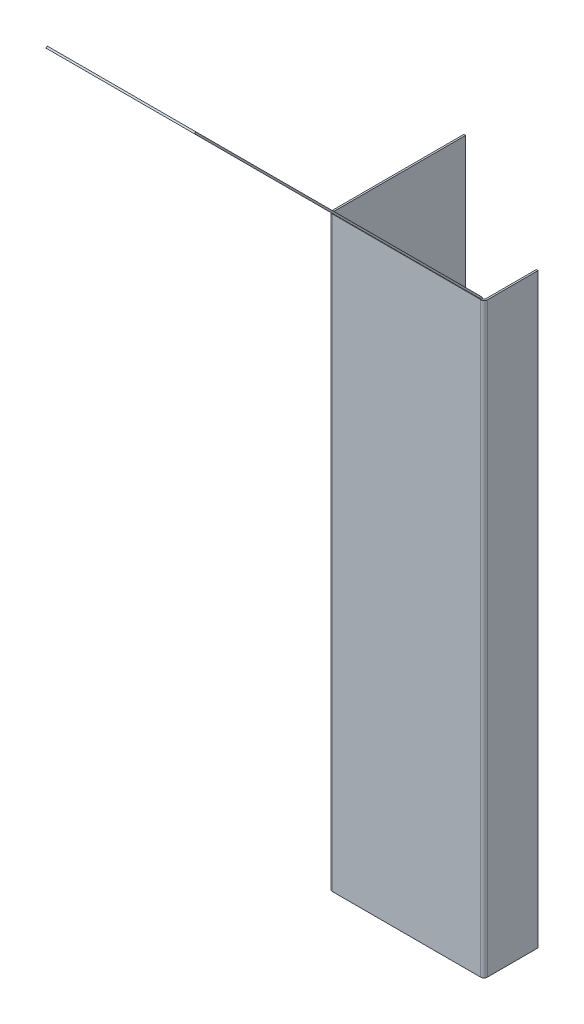
from build123d import *

# Parameters (mm, degrees)
BASE_FLANGE1_DEPTH = 69.85
EDGE_FLANGE1_DEPTH = 276.04689029
EDGE_FLANGE3_DEPTH = 276.04689029
CUT_EXTRUDE1_REACH = 441.211
SKETCH16_W         = 8.739840912
SKETCH16_H         = 76.2


# Sheet-metal steps are written as plain solids
with BuildPart() as part:
    # Sketch1 → Base-Flange1 (new body)
    with BuildSketch(Plane(origin=(0, 0, 0), x_dir=(0, 0, -1), z_dir=(1, 0, 0))):
        with BuildLine():
            Line((0, 0), (0, 276.04689029))
            ThreePointArc((0, 276.04689029), (-0.056070336, 276.328774906), (-0.215745145, 276.567745145))
            Line((-0.215745145, 276.567745145), (-134.703841816, 411.055841816))
            Line((-134.703841816, 411.055841816), (-134.129105424, 411.630578208))
            Line((-134.129105424, 411.630578208), (0.358991247, 277.142481537))
            ThreePointArc((0.358991247, 277.142481537), (0.694858948, 276.63982), (0.8128, 276.04689029))
            Line((0.8128, 276.04689029), (0.8128, 0))
            Line((0.8128, 0), (0, 0))
        make_face()
    extrude(amount=BASE_FLANGE1_DEPTH)

    # Edge-Flange1 section (across the edge) → Edge-Flange1 (add)
    with BuildSketch(Plane(origin=(70.5866, 276.04689029, -0.8128), x_dir=(-1, 0, 0), z_dir=(0, -1, 0))):
        with BuildLine():
            Line((-0.8128, 0.7366), (-0.8128, 24.5872))
            Line((-0.8128, 24.5872), (0, 24.5872))
            Line((0, 24.5872), (0, 0.7366))
            ThreePointArc((0, 0.7366), (0.215745145, 0.215745145), (0.7366, 0))
            Line((0.7366, 0), (0.7366, -0.8128))
            ThreePointArc((0.7366, -0.8128), (-0.358991247, -0.358991247), (-0.8128, 0.7366))
        make_face()
    extrude(amount=EDGE_FLANGE1_DEPTH)

    # Edge-Flange3 section (across the edge) → Edge-Flange3 (add)
    with BuildSketch(Plane(origin=(-0.7366, 0, -0.8128), x_dir=(1, 0, 0), z_dir=(0, 1, 0))):
        with BuildLine():
            Line((-0.8128, 0.7366), (-0.8128, 62.6872))
            Line((-0.8128, 62.6872), (0, 62.6872))
            Line((0, 62.6872), (0, 0.7366))
            ThreePointArc((0, 0.7366), (0.215745145, 0.215745145), (0.7366, 0))
            Line((0.7366, 0), (0.7366, -0.8128))
            ThreePointArc((0.7366, -0.8128), (-0.358991247, -0.358991247), (-0.8128, 0.7366))
        make_face()
    extrude(amount=EDGE_FLANGE3_DEPTH)

    # Sketch16 → Cut-Extrude1 (cut, up to next)
    with BuildSketch(Plane.ZY.offset(1.5494), mode=Mode.PRIVATE) as cut_extrude1_sk1:
        with Locations((-59.130079544, 92.075)):
            Rectangle(SKETCH16_W, SKETCH16_H)
    cut_extrude1_tool1 = extrude(cut_extrude1_sk1.sketch, amount=-CUT_EXTRUDE1_REACH, mode=Mode.PRIVATE) & part.part
    add(cut_extrude1_tool1.solids().sort_by_distance((-1.5494, 92.075, -59.13008))[0], mode=Mode.SUBTRACT)


solid = part.part
